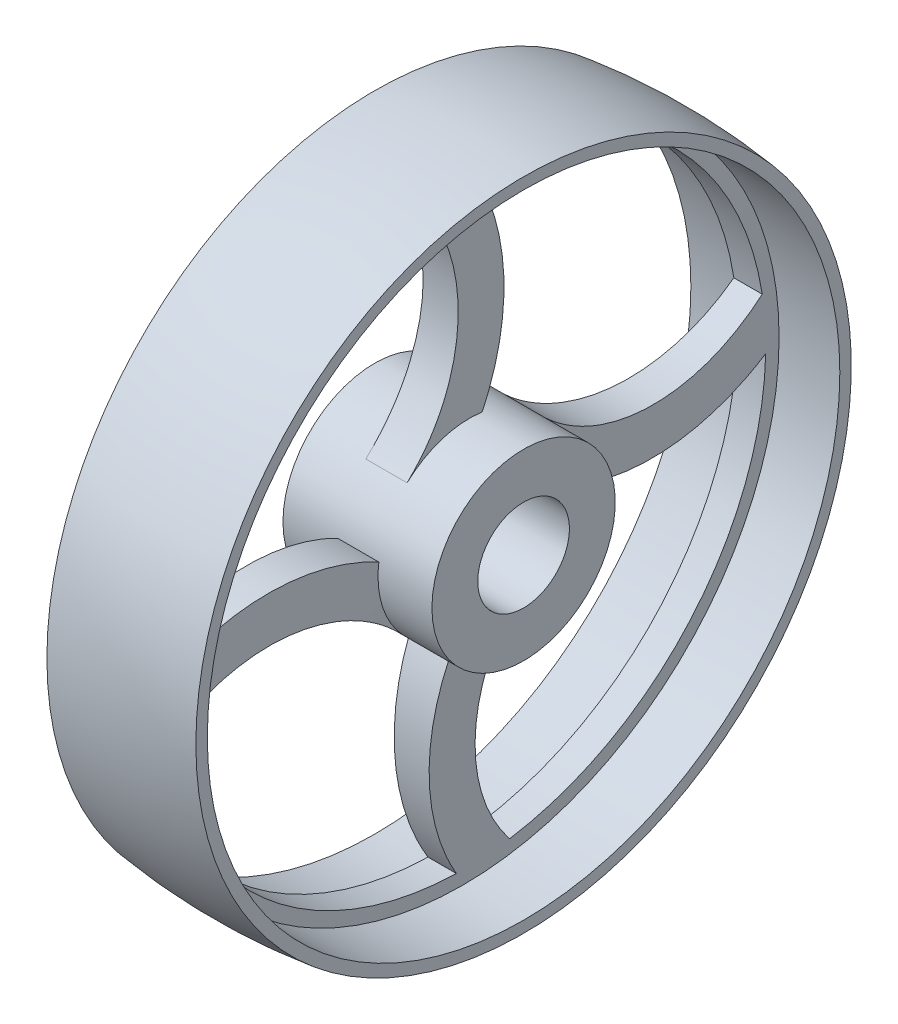
from build123d import *

# Parameters (mm, degrees)
CUT_EXTRUDE6_DEPTH      = 208.620447125
CUT_EXTRUDE6_DEPTH_BACK = 208.620447125


with BuildPart() as part:
    # Sketch2 → Revolve2 (revolve)
    with BuildSketch(Plane.XY):
        with BuildLine():
            Line((-32.5, 20), (32.5, 20))
            Line((32.5, 20), (32.5, 40))
            Line((32.5, 40), (9, 40))
            Line((9, 40), (6, 138))
            Line((6, 138), (32.5, 138))
            Line((32.5, 138), (32.5, 143))
            ThreePointArc((32.5, 143), (0, 145), (-32.5, 143))
            Line((-32.5, 143), (-32.5, 138))
            Line((-32.5, 138), (-6, 138))
            Line((-6, 138), (-9, 40))
            Line((-9, 40), (-32.5, 40))
            Line((-32.5, 40), (-32.5, 20))
        make_face()
    revolve(axis=Axis((-129.939855751, 0, 0), (1, 0, 0)))

    # Sketch3 → Cut-Extrude6 (cut, two sides: drawn at the far end of the back side and taken through both)
    with BuildSketch(Plane(origin=(0, 0, 0), x_dir=(0, 0, -1), z_dir=(1, 0, 0)).offset(-CUT_EXTRUDE6_DEPTH_BACK)):
        with BuildLine():
            ThreePointArc((-27.328945398, 29.208367695), (-35.530356849, 18.373724232), (-39.631284236, 5.418607739))
            ThreePointArc((-39.631284236, 5.418607739), (-86.110435123, 16.261066479), (-131.965338139, 3.024818968))
            ThreePointArc((-131.965338139, 3.024818968), (-99.237955375, 87.039233757), (-20.209189285, 130.443814221))
            ThreePointArc((-20.209189285, 130.443814221), (-3.890901617, 78.428085647), (-27.328945398, 29.208367695))
        make_face()
        with BuildLine():
            ThreePointArc((-5.418607739, -39.631284236), (-16.261066479, -86.110435123), (-3.024818968, -131.965338139))
            ThreePointArc((-3.024818968, -131.965338139), (-87.039233757, -99.237955375), (-130.443814221, -20.209189285))
            ThreePointArc((-130.443814221, -20.209189285), (-78.428085647, -3.890901617), (-29.208367695, -27.328945398))
            ThreePointArc((-29.208367695, -27.328945398), (-18.373724232, -35.530356849), (-5.418607739, -39.631284236))
        make_face()
        with BuildLine():
            ThreePointArc((29.208367695, 27.328945398), (18.373724232, 35.530356849), (5.418607739, 39.631284236))
            ThreePointArc((5.418607739, 39.631284236), (16.261066479, 86.110435123), (3.024818968, 131.965338139))
            ThreePointArc((3.024818968, 131.965338139), (87.039233757, 99.237955375), (130.443814221, 20.209189285))
            ThreePointArc((130.443814221, 20.209189285), (78.428085647, 3.890901617), (29.208367695, 27.328945398))
        make_face()
        with BuildLine():
            ThreePointArc((27.328945398, -29.208367695), (35.530356849, -18.373724232), (39.631284236, -5.418607739))
            ThreePointArc((39.631284236, -5.418607739), (86.110435123, -16.261066479), (131.965338139, -3.024818968))
            ThreePointArc((131.965338139, -3.024818968), (99.237955375, -87.039233757), (20.209189285, -130.443814221))
            ThreePointArc((20.209189285, -130.443814221), (3.890901617, -78.428085647), (27.328945398, -29.208367695))
        make_face()
    extrude(amount=CUT_EXTRUDE6_DEPTH + CUT_EXTRUDE6_DEPTH_BACK, mode=Mode.SUBTRACT)


solid = part.part
